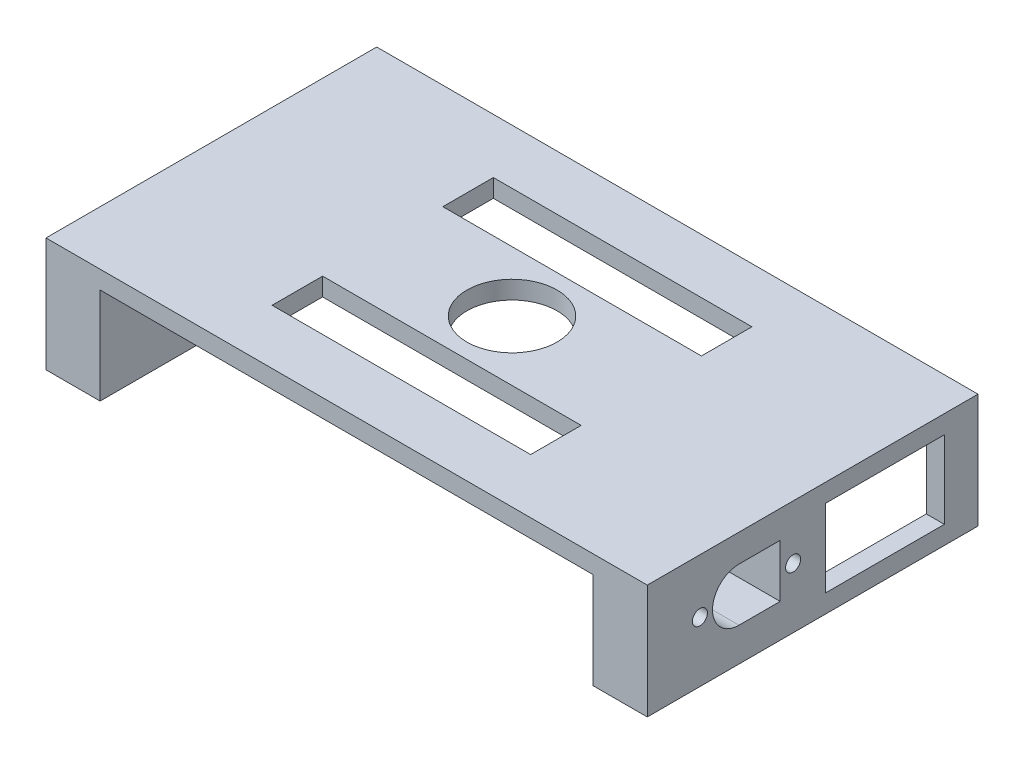
from build123d import *

# Parameters (mm, degrees)
SKETCH1_W           = 100
SKETCH1_H           = 55
BOSS_EXTRUDE1_DEPTH = 19
SKETCH2_W           = 82
SKETCH2_H           = 91
CUT_EXTRUDE1_DEPTH  = 16
CUT_EXTRUDE3_REACH  = 107.438
SKETCH3_R           = 1.25
CUT_EXTRUDE13_REACH = 107.438
SKETCH15_W          = 19.8
SKETCH15_H          = 12.9
CUT_EXTRUDE14_REACH = 62.144
SKETCH6_R           = 7.5
SKETCH6_W           = 43
SKETCH6_H           = 8.4
SKETCH16_W          = 6
SKETCH16_H          = 27.5
CUT_EXTRUDE15_DEPTH = 16


with BuildPart() as part:
    # Sketch1 → Boss-Extrude1 (new body)
    with BuildSketch(Plane(origin=(0, 0, 0), x_dir=(1, 0, 0), z_dir=(0, 1, 0))):
        Rectangle(SKETCH1_W, SKETCH1_H)
    extrude(amount=BOSS_EXTRUDE1_DEPTH)

    # Sketch2 → Cut-Extrude1 (cut)
    with BuildSketch(Plane.XZ):
        Rectangle(SKETCH2_W, SKETCH2_H)
    extrude(amount=-CUT_EXTRUDE1_DEPTH, mode=Mode.SUBTRACT)

    # Sketch3 → Cut-Extrude3 (cut, up to next)
    with BuildSketch(Plane(origin=(50, 0, 0), x_dir=(0, 0, -1), z_dir=(1, 0, 0)), mode=Mode.PRIVATE) as cut_extrude3_sk1:
        with Locations((-18.75, 10)):
            Circle(SKETCH3_R)
    cut_extrude3_tool1 = extrude(cut_extrude3_sk1.sketch, amount=-CUT_EXTRUDE3_REACH, mode=Mode.PRIVATE) & part.part
    # Sketch3 → Cut-Extrude3 (cut, up to next)
    with BuildSketch(Plane(origin=(50, 0, 0), x_dir=(0, 0, -1), z_dir=(1, 0, 0)), mode=Mode.PRIVATE) as cut_extrude3_sk2:
        with Locations((-3.25, 10)):
            Circle(SKETCH3_R)
    cut_extrude3_tool2 = extrude(cut_extrude3_sk2.sketch, amount=-CUT_EXTRUDE3_REACH, mode=Mode.PRIVATE) & part.part
    # Sketch3 → Cut-Extrude3 (cut, up to next)
    with BuildSketch(Plane(origin=(50, 0, 0), x_dir=(0, 0, -1), z_dir=(1, 0, 0)), mode=Mode.PRIVATE) as cut_extrude3_sk3:
        with BuildLine():
            Line((-5.4, 5.6), (-5.4, 14.4))
            Line((-5.4, 14.4), (-12.25, 14.4))
            ThreePointArc((-12.25, 14.4), (-16.65, 10), (-12.25, 5.6))
            Line((-12.25, 5.6), (-5.4, 5.6))
        make_face()
    cut_extrude3_tool3 = extrude(cut_extrude3_sk3.sketch, amount=-CUT_EXTRUDE3_REACH, mode=Mode.PRIVATE) & part.part
    add(cut_extrude3_tool1.solids().sort_by_distance((50, 10, 18.75))[0], mode=Mode.SUBTRACT)
    add(cut_extrude3_tool2.solids().sort_by_distance((50, 10, 3.25))[0], mode=Mode.SUBTRACT)
    add(cut_extrude3_tool3.solids().sort_by_distance((50, 10, 10.599668))[0], mode=Mode.SUBTRACT)

    # Sketch15 → Cut-Extrude13 (cut, up to next)
    with BuildSketch(Plane(origin=(50, 0, 0), x_dir=(0, 0, -1), z_dir=(1, 0, 0)), mode=Mode.PRIVATE) as cut_extrude13_sk1:
        with Locations((12, 9.5)):
            Rectangle(SKETCH15_W, SKETCH15_H)
    cut_extrude13_tool1 = extrude(cut_extrude13_sk1.sketch, amount=-CUT_EXTRUDE13_REACH, mode=Mode.PRIVATE) & part.part
    add(cut_extrude13_tool1.solids().sort_by_distance((50, 9.5, -12))[0], mode=Mode.SUBTRACT)

    # Sketch6 → Cut-Extrude14 (cut, up to next)
    with BuildSketch(Plane(origin=(0, 19, 0), x_dir=(1, 0, 0), z_dir=(0, 1, 0)), mode=Mode.PRIVATE) as cut_extrude14_sk1:
        Circle(SKETCH6_R)
    cut_extrude14_tool1 = extrude(cut_extrude14_sk1.sketch, amount=-CUT_EXTRUDE14_REACH, mode=Mode.PRIVATE) & part.part
    # Sketch6 → Cut-Extrude14 (cut, up to next)
    with BuildSketch(Plane(origin=(0, 19, 0), x_dir=(1, 0, 0), z_dir=(0, 1, 0)), mode=Mode.PRIVATE) as cut_extrude14_sk2:
        with Locations((0, -14.2)):
            Rectangle(SKETCH6_W, SKETCH6_H)
    cut_extrude14_tool2 = extrude(cut_extrude14_sk2.sketch, amount=-CUT_EXTRUDE14_REACH, mode=Mode.PRIVATE) & part.part
    # Sketch6 → Cut-Extrude14 (cut, up to next)
    with BuildSketch(Plane(origin=(0, 19, 0), x_dir=(1, 0, 0), z_dir=(0, 1, 0)), mode=Mode.PRIVATE) as cut_extrude14_sk3:
        with Locations((0, 14.2)):
            Rectangle(SKETCH6_W, SKETCH6_H)
    cut_extrude14_tool3 = extrude(cut_extrude14_sk3.sketch, amount=-CUT_EXTRUDE14_REACH, mode=Mode.PRIVATE) & part.part
    add(cut_extrude14_tool1.solids().sort_by_distance((0, 19, 0))[0], mode=Mode.SUBTRACT)
    add(cut_extrude14_tool2.solids().sort_by_distance((0, 19, 14.2))[0], mode=Mode.SUBTRACT)
    add(cut_extrude14_tool3.solids().sort_by_distance((0, 19, -14.2))[0], mode=Mode.SUBTRACT)

    # Sketch16 → Cut-Extrude15 (cut)
    with BuildSketch(Plane.XZ):
        with Locations((44, -13.75)):
            Rectangle(SKETCH16_W, SKETCH16_H)
    extrude(amount=-CUT_EXTRUDE15_DEPTH, mode=Mode.SUBTRACT)


solid = part.part
